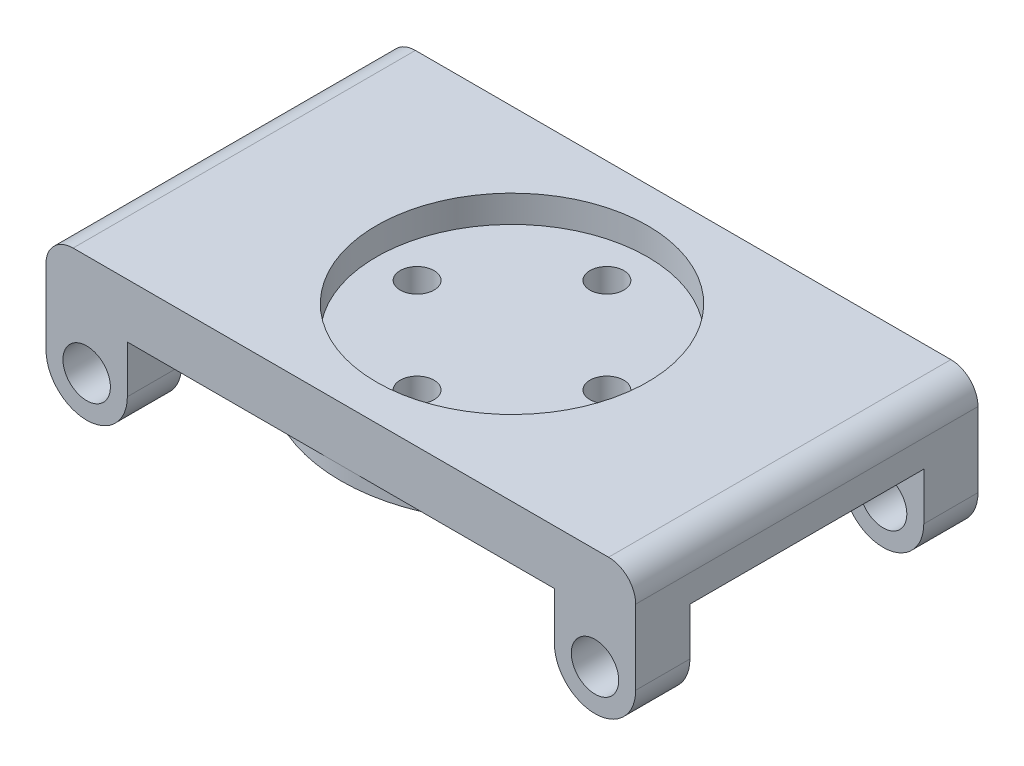
from build123d import *

# Parameters (mm, degrees)
SKETCH1_W           = 43.5
SKETCH1_H           = 25.25
BOSS_EXTRUDE1_DEPTH = 4
SKETCH5_R           = 10
CUT_EXTRUDE3_DEPTH  = 2
SKETCH6_R           = 12.625
BOSS_EXTRUDE3_DEPTH = 1
SKETCH2_R           = 1.25
CUT_EXTRUDE4_DEPTH  = 26.640848757
SKETCH4_R           = 1.75
BOSS_EXTRUDE2_DEPTH = 4
FILLET1_R           = 2


with BuildPart() as part:
    # Sketch1 → Boss-Extrude1 (new body)
    with BuildSketch(Plane(origin=(0, 0, 0), x_dir=(1, 0, 0), z_dir=(0, 1, 0))):
        Rectangle(SKETCH1_W, SKETCH1_H)
    extrude(amount=BOSS_EXTRUDE1_DEPTH)

    # Sketch5 → Cut-Extrude3 (cut)
    with BuildSketch(Plane(origin=(0, 4, 0), x_dir=(1, 0, 0), z_dir=(0, 1, 0))):
        Circle(SKETCH5_R)
    extrude(amount=-CUT_EXTRUDE3_DEPTH, mode=Mode.SUBTRACT)

    # Sketch6 → Boss-Extrude3 (add)
    with BuildSketch(Plane.XZ):
        Circle(SKETCH6_R)
    extrude(amount=BOSS_EXTRUDE3_DEPTH)

    # Sketch2 → Cut-Extrude4 (cut, through all)
    with BuildSketch(Plane(origin=(0, 4, 0), x_dir=(1, 0, 0), z_dir=(0, 1, 0))):
        with Locations((0, 7)):
            Circle(SKETCH2_R)
        with Locations((7, 0)):
            Circle(SKETCH2_R)
        with Locations((0, -7)):
            Circle(SKETCH2_R)
        with Locations((-7, 0)):
            Circle(SKETCH2_R)
    extrude(amount=-CUT_EXTRUDE4_DEPTH, mode=Mode.SUBTRACT)

    # Sketch4 → Boss-Extrude2 (add)
    # profile 1 of 2: a face of its own
    with BuildSketch(Plane.XY.offset(12.625)):
        with BuildLine():
            Line((-15.75, 0), (-21.75, 0))
            Line((-21.75, 0), (-21.75, -3.5))
            ThreePointArc((-21.75, -3.5), (-18.75, -6.5), (-15.75, -3.5))
            Line((-15.75, -3.5), (-15.75, 0))
        make_face()
        with Locations((-18.75, -3.5)):
            Circle(SKETCH4_R, mode=Mode.SUBTRACT)
    # profile 2 of 2: a face of its own
    with BuildSketch(Plane.XY.offset(12.625)):
        with BuildLine():
            Line((21.75, -3.5), (21.75, 0))
            Line((21.75, 0), (15.75, 0))
            Line((15.75, 0), (15.75, -3.5))
            ThreePointArc((15.75, -3.5), (18.75, -6.5), (21.75, -3.5))
        make_face()
        with Locations((18.75, -3.5)):
            Circle(SKETCH4_R, mode=Mode.SUBTRACT)
    boss_extrude2 = extrude(amount=-BOSS_EXTRUDE2_DEPTH)

    # Mirror1: Boss-Extrude2 across plane
    add(boss_extrude2.mirror(Plane.XY))

    # Fillet1
    fillet1_edges = [part.edges().sort_by_distance(p)[0] for p in [
        (21.75, 4, 0),
        (-21.75, 4, 0),
    ]]
    fillet(fillet1_edges, radius=FILLET1_R)


solid = part.part
